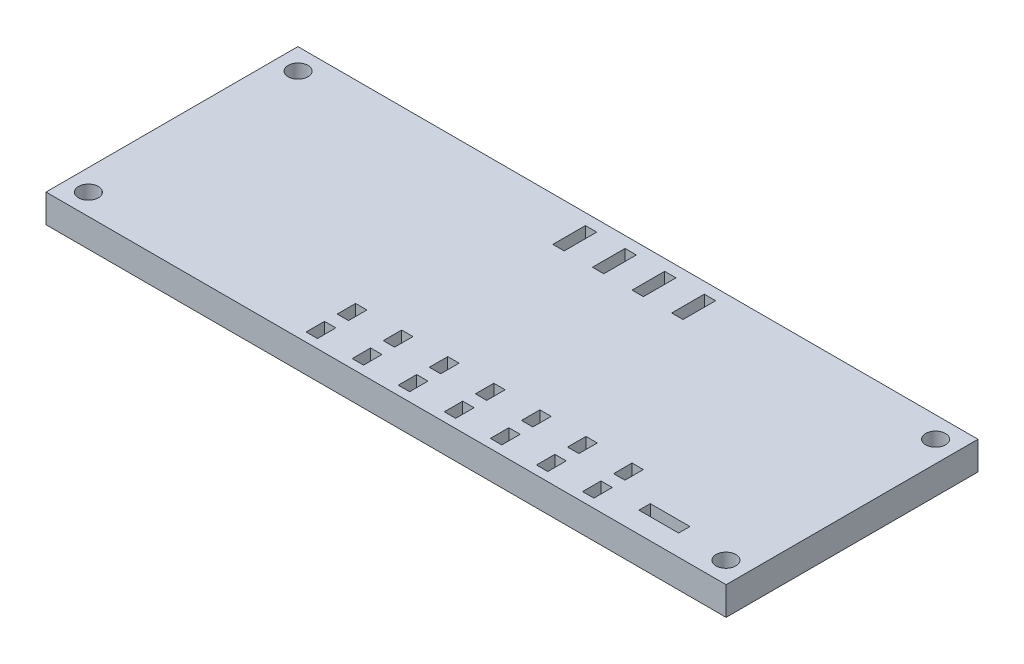
from build123d import *

# Parameters (mm, degrees)
SKETCH_1_W                  = 120.015
SKETCH_1_H                  = 44.45
EXTRUDE_1_DEPTH             = 5
SKETCH_2_R                  = 1.75
CUT_EXTRUDE_4_DEPTH         = 5
MIRROR_2_COPY_1_SKETCH_R    = 1.75
MIRROR_2_COPY_1_DEPTH       = 5
MIRROR_2_COPY_2_SKETCH_R    = 1.75
MIRROR_2_COPY_2_DEPTH       = 5
SKETCH_3_W                  = 2
SKETCH_3_H                  = 3.2499848
CUT_EXTRUDE_5_DEPTH         = 5
PATTERN_LINEAR_1_COUNT      = 7
PATTERN_LINEAR_1_PITCH      = 8.13
PATTERN_LINEAR_1_COUNT_DIR2 = 2
PATTERN_LINEAR_1_PITCH_DIR2 = 5.48
SKETCH_4_W                  = 2
SKETCH_4_H                  = 5.7500052
CUT_EXTRUDE_6_DEPTH         = 5
PATTERN_LINEAR_2_COUNT      = 4
PATTERN_LINEAR_2_PITCH      = 6.99
SKETCH_5_W                  = 6.99999
SKETCH_5_H                  = 2
CUT_EXTRUDE_7_DEPTH         = 5


with BuildPart() as part:
    # 草图1 → 凸台-拉伸1 (new body)
    with BuildSketch(Plane(origin=(0, 0, 0), x_dir=(1, 0, 0), z_dir=(0, 1, 0))):
        Rectangle(SKETCH_1_W, SKETCH_1_H)
    extrude(amount=EXTRUDE_1_DEPTH)

    # 草图2 → 切除-拉伸4 (cut)
    with BuildSketch(Plane(origin=(0, 0, 0), x_dir=(1, 0, 0), z_dir=(0, 1, 0))):
        with Locations((-56.25, 18.5)):
            Circle(SKETCH_2_R)
    cut_extrude_4 = extrude(amount=CUT_EXTRUDE_4_DEPTH, mode=Mode.SUBTRACT)

    # 镜向1: 切除-拉伸4 across plane
    add(cut_extrude_4.mirror(Plane.XY), mode=Mode.SUBTRACT)

    # 镜向2 copy 1 sketch → 镜向2 copy 1 (cut)
    with BuildSketch(Plane(origin=(0, 0, 0), x_dir=(-1, 0, 0), z_dir=(0, 1, 0))):
        with Locations((-56.25, 18.5)):
            Circle(MIRROR_2_COPY_1_SKETCH_R)
    extrude(amount=MIRROR_2_COPY_1_DEPTH, mode=Mode.SUBTRACT)

    # 镜向2 copy 2 sketch → 镜向2 copy 2 (cut)
    with BuildSketch(Plane(origin=(0, 0, 0), x_dir=(-1, 0, 0), z_dir=(0, 1, 0))):
        with Locations((-56.25, -18.5)):
            Circle(MIRROR_2_COPY_2_SKETCH_R)
    extrude(amount=MIRROR_2_COPY_2_DEPTH, mode=Mode.SUBTRACT)

    # 草图3 → 切除-拉伸5 (cut)
    with BuildSketch(Plane(origin=(0, 5, 0), x_dir=(1, 0, 0), z_dir=(0, 1, 0))):
        with Locations((-14.6685, -13.5579612)):
            Rectangle(SKETCH_3_W, SKETCH_3_H)
    cut_extrude_5 = extrude(amount=-CUT_EXTRUDE_5_DEPTH, mode=Mode.SUBTRACT)

    # 阵列(线性)1: Cut-Extrude 5 7 × 2
    with Locations(*[(i * PATTERN_LINEAR_1_PITCH, 0, j * PATTERN_LINEAR_1_PITCH_DIR2) for i in range(PATTERN_LINEAR_1_COUNT) for j in range(PATTERN_LINEAR_1_COUNT_DIR2) if (i, j) != (0, 0)]):
        add(cut_extrude_5, mode=Mode.SUBTRACT)

    # 草图4 → 切除-拉伸6 (cut)
    with BuildSketch(Plane(origin=(0, 5, 0), x_dir=(1, 0, 0), z_dir=(0, 1, 0))):
        with Locations((-6.2865, 17.3690026)):
            Rectangle(SKETCH_4_W, SKETCH_4_H)
    cut_extrude_6 = extrude(amount=-CUT_EXTRUDE_6_DEPTH, mode=Mode.SUBTRACT)

    # 阵列(线性)2: 切除-拉伸6 ×4
    with Locations(*[(i * PATTERN_LINEAR_2_PITCH, 0, 0) for i in range(1, PATTERN_LINEAR_2_COUNT)]):
        add(cut_extrude_6, mode=Mode.SUBTRACT)

    # 草图5 → 切除-拉伸7 (cut)
    with BuildSketch(Plane(origin=(0, 5, 0), x_dir=(1, 0, 0), z_dir=(0, 1, 0))):
        with Locations((44.426505, -17.526)):
            Rectangle(SKETCH_5_W, SKETCH_5_H)
    extrude(amount=-CUT_EXTRUDE_7_DEPTH, mode=Mode.SUBTRACT)


solid = part.part
